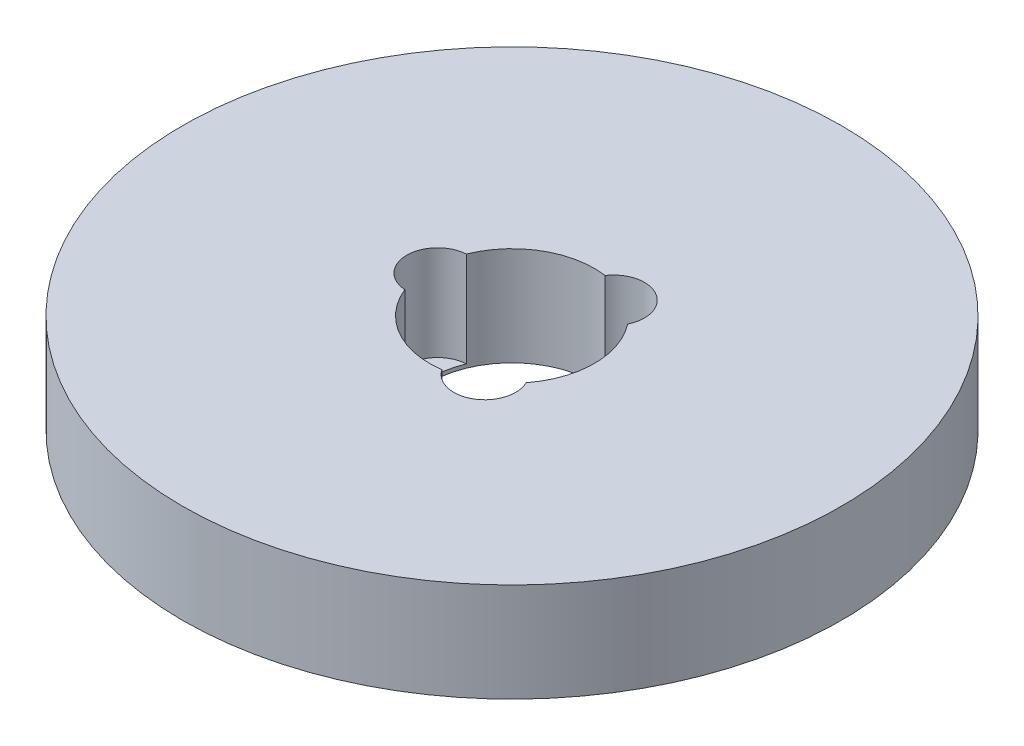
from build123d import *

# Parameters (mm, degrees)
SKETCH1_R           = 30
BOSS_EXTRUDE1_DEPTH = 9
SKETCH2_R           = 7.5
CUT_EXTRUDE1_DEPTH  = 44.370496884
SKETCH3_R           = 2.813276568
CUT_EXTRUDE2_DEPTH  = 8.656569748
CIRPATTERN1_COUNT   = 3


with BuildPart() as part:
    # Sketch1 → Boss-Extrude1 (new body)
    with BuildSketch(Plane(origin=(0, 0, 0), x_dir=(1, 0, 0), z_dir=(0, 1, 0))):
        Circle(SKETCH1_R)
    extrude(amount=BOSS_EXTRUDE1_DEPTH)

    # Sketch2 → Cut-Extrude1 (cut, through all)
    with BuildSketch(Plane(origin=(0, 0, 0), x_dir=(1, 0, 0), z_dir=(0, 1, 0))):
        Circle(SKETCH2_R)
    extrude(amount=CUT_EXTRUDE1_DEPTH, mode=Mode.SUBTRACT)

    # Sketch3 → Cut-Extrude2 (cut)
    with BuildSketch(Plane(origin=(0, 9, 0), x_dir=(1, 0, 0), z_dir=(0, 1, 0))):
        with Locations((-6.768694907, 0)):
            Circle(SKETCH3_R)
    cut_extrude2 = extrude(amount=-CUT_EXTRUDE2_DEPTH, mode=Mode.SUBTRACT)

    # CirPattern1: Cut-Extrude2 ×3 about axis
    cirpattern1_axis = Axis((0, 0, 0), (0, 1, 0))
    for i in range(1, CIRPATTERN1_COUNT):
        add(cut_extrude2.rotate(cirpattern1_axis, i * 360 / CIRPATTERN1_COUNT), mode=Mode.SUBTRACT)


solid = part.part
